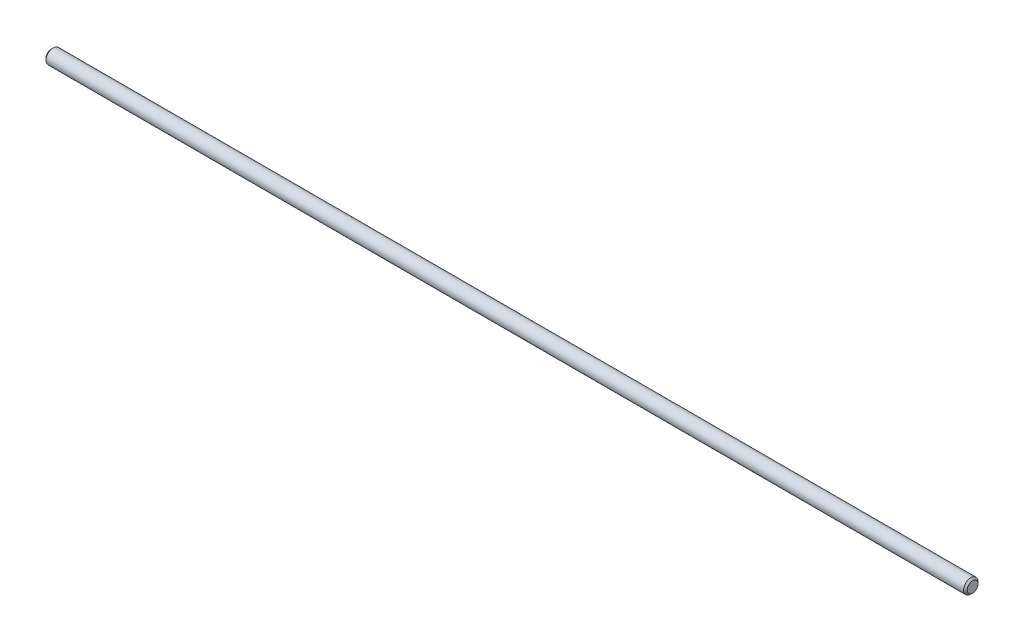
from build123d import *

# Parameters (mm, degrees)
SKETCH2_R           = 4.7625
BOSS_EXTRUDE1_DEPTH = 609.6
CHAMFER1_SIZE       = 1.190625


with BuildPart() as part:
    # Sketch2 → Boss-Extrude1 (new body)
    with BuildSketch(Plane(origin=(0, 0, 0), x_dir=(0, 0, -1), z_dir=(1, 0, 0))):
        Circle(SKETCH2_R)
    extrude(amount=-BOSS_EXTRUDE1_DEPTH)

    # Chamfer1
    chamfer1_edges = [part.edges().sort_by_distance(p)[0] for p in [
        (-609.6, 0, 4.7625),
        (0, 0, 4.7625),
    ]]
    chamfer(chamfer1_edges, length=CHAMFER1_SIZE)


solid = part.part
